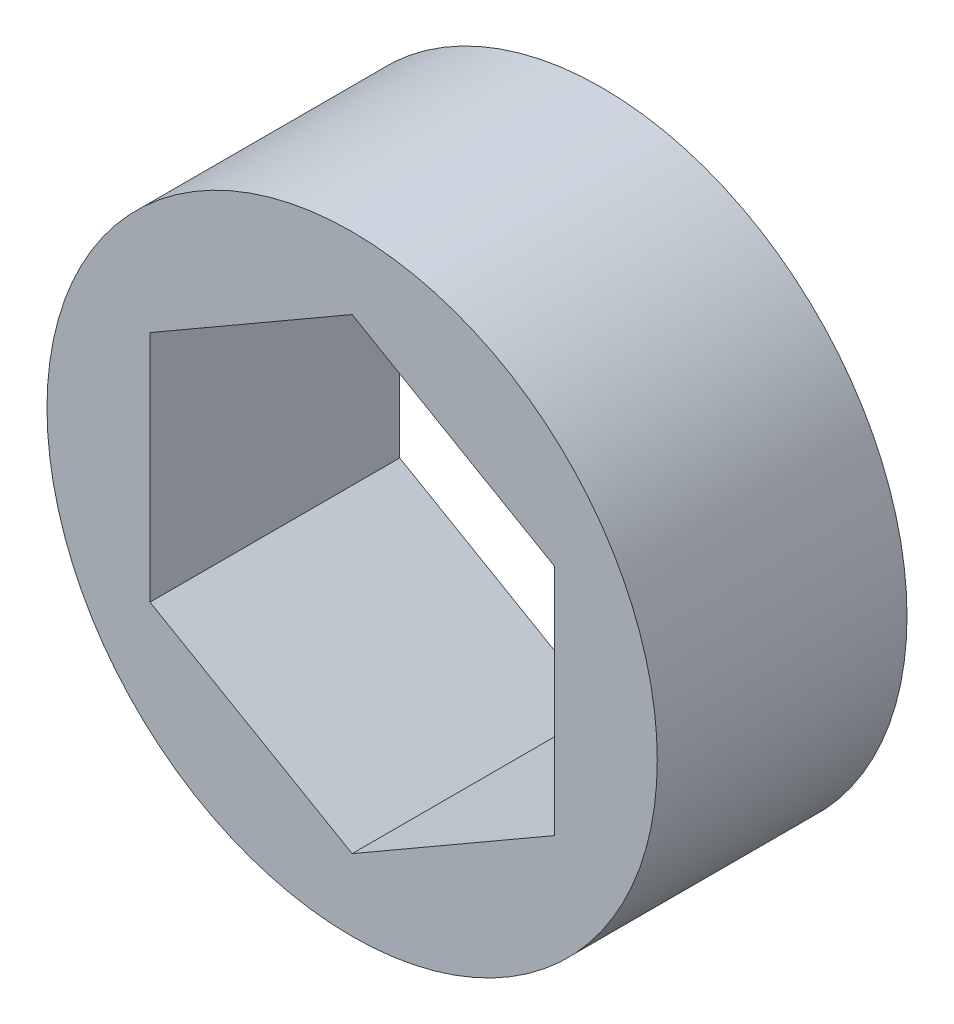
from build123d import *

# Parameters (mm, degrees)
SKETCH1_R           = 10.16
BOSS_EXTRUDE1_DEPTH = 8.314500008


with BuildPart() as part:
    # Sketch1 → Boss-Extrude1 (new body)
    with BuildSketch(Plane.XY):
        Circle(SKETCH1_R)
        Polygon((6.731, 3.886144662), (0, 7.772289324), (-6.731, 3.886144662), (-6.731, -3.886144662), (0, -7.772289324), (6.731, -3.886144662), align=None, mode=Mode.SUBTRACT)
    extrude(amount=BOSS_EXTRUDE1_DEPTH)


solid = part.part
